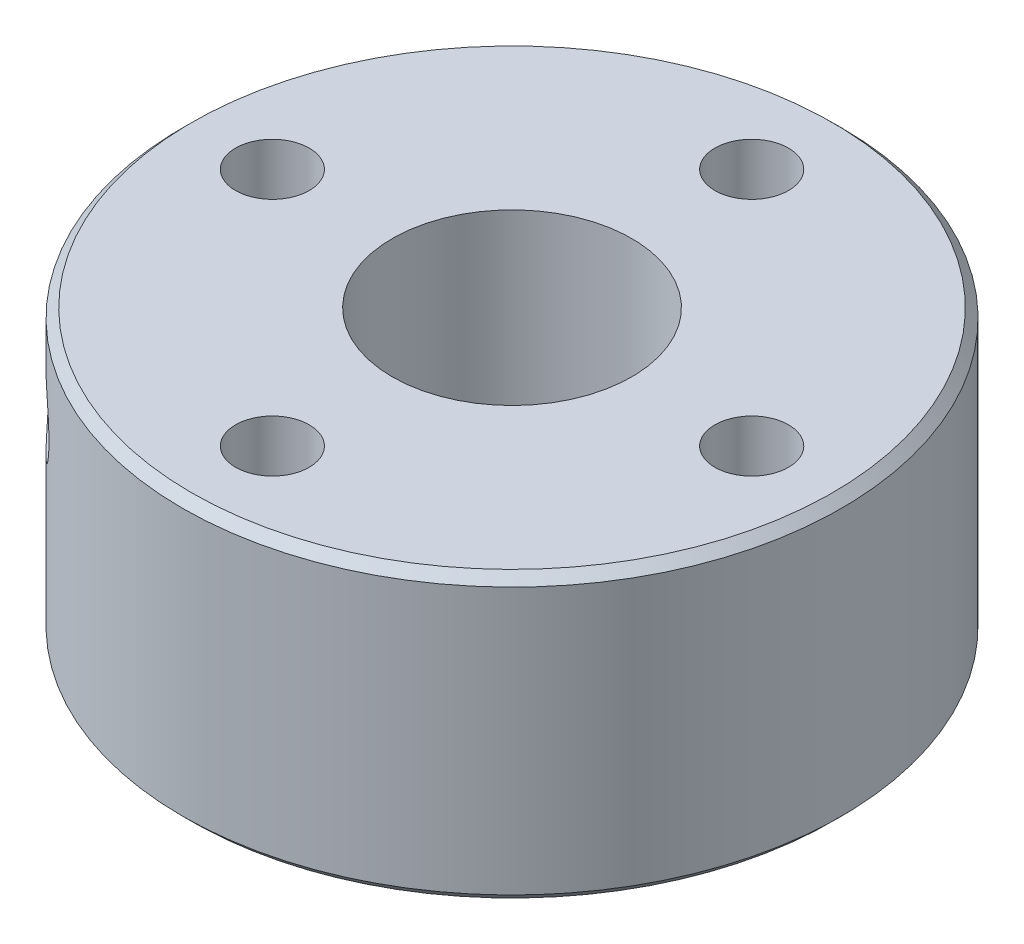
from build123d import *

# Parameters (mm, degrees)
SCHIZZO1_W                                           = 11
SCHIZZO1_H                                           = 9.5
SCHIZZO2_R                                           = 4.75
ESTRUSIONE_ESTRUSIONE1_DEPTH                         = 3.5
FORO_PER_VITE_M2_1_D                                 = 2.459
FORO_PER_VITE_M2_1_DEPTH                             = 13
FORO_LAMATO_PER_VITE_M3_5_A_TESTA_ESAGON_D           = 4
FORO_LAMATO_PER_VITE_M3_5_A_TESTA_ESAGON_CBORE_D     = 8
FORO_LAMATO_PER_VITE_M3_5_A_TESTA_ESAGON_CBORE_DEPTH = 8.5
SCHIZZO7_W                                           = 1.2295
SCHIZZO7_H                                           = 11.749995321
SMUSSO1_SIZE                                         = 0.3


with BuildPart() as part:
    # Schizzo1 → Rivoluzione1 (revolve)
    with BuildSketch(Plane(origin=(0, 0, 0), x_dir=(-1, 0, 0), z_dir=(0, 0, -1))):
        with Locations((-5.5, 8.25)):
            Rectangle(SCHIZZO1_W, SCHIZZO1_H)
    revolve(axis=Axis((0, 3.5, 0), (0, 1, 0)))

    # Schizzo2 → Estrusione-Estrusione1 (add)
    with BuildSketch(Plane.XZ.offset(-3.5)):
        Circle(SCHIZZO2_R)
    extrude(amount=ESTRUSIONE_ESTRUSIONE1_DEPTH)

    # Foro per Vite M2-1
    with Locations(Plane(origin=(0, 13, 0), x_dir=(1, 0, 0), z_dir=(0, 1, 0))):
        with Locations((0, 8), (-8, 0), (0, -8), (8, 0)):
            Hole(FORO_PER_VITE_M2_1_D / 2, depth=FORO_PER_VITE_M2_1_DEPTH)

    # Foro lamato per Vite M3.5 a testa esagonale-1 (through all)
    with Locations(Plane(origin=(0, 13, 0), x_dir=(1, 0, 0), z_dir=(0, 1, 0))):
        with Locations((0, 0)):
            CounterBoreHole(FORO_LAMATO_PER_VITE_M3_5_A_TESTA_ESAGON_D / 2, FORO_LAMATO_PER_VITE_M3_5_A_TESTA_ESAGON_CBORE_D / 2, FORO_LAMATO_PER_VITE_M3_5_A_TESTA_ESAGON_CBORE_DEPTH)

    # Schizzo7 → Foro per Vite M2-2 (revolve, cut)
    with BuildSketch(Plane(origin=(-2.69149863, 10, 2.69149863), x_dir=(-0.7071067811865475, 0, -0.7071067811865477), z_dir=(0, 1, 0))):
        with Locations((0.61475, 5.874997661)):
            Rectangle(SCHIZZO7_W, SCHIZZO7_H)
    revolve(axis=Axis((1.798629431, 10, -1.798629431), (-0.7071067811865477, 0, 0.7071067811865474)), mode=Mode.SUBTRACT)

    # Smusso1
    smusso1_edges = [part.edges().sort_by_distance(p)[0] for p in [
        (-4.75, 0, 0),
        (-11, 3.5, 0),
        (-11, 13, 0),
    ]]
    chamfer(smusso1_edges, length=SMUSSO1_SIZE)


solid = part.part
